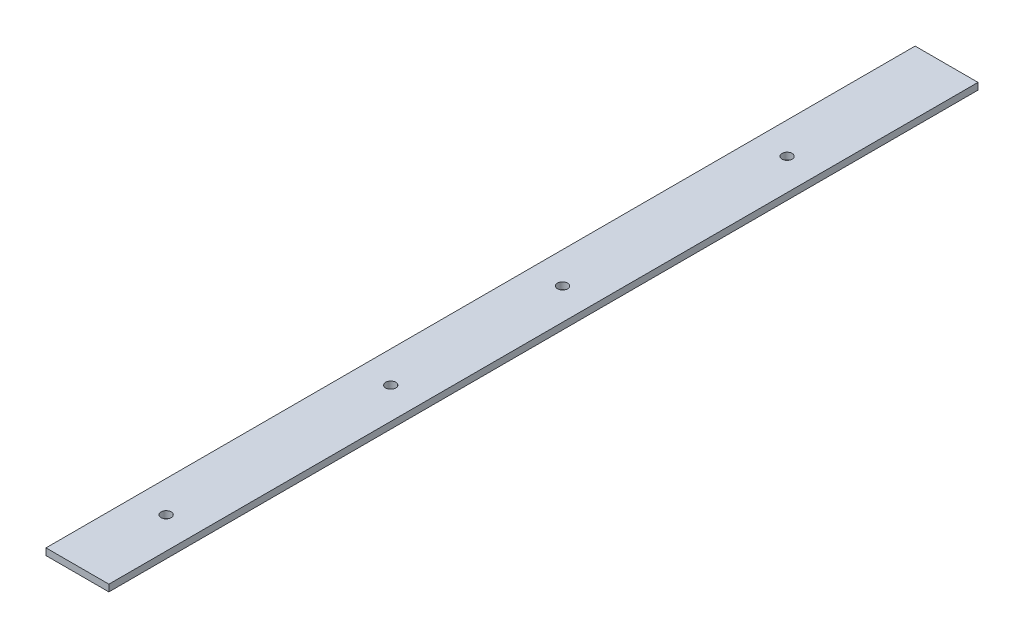
from build123d import *

# Parameters (mm, degrees)
SKETCH1_W            = 28
SKETCH1_H            = 387
BOSS_EXTRUDE1_DEPTH  = 3
M4_CLEARANCE_HOLE1_D = 4.5
LPATTERN2_COUNT      = 2
LPATTERN2_PITCH      = 176.5


with BuildPart() as part:
    # Sketch1 → Boss-Extrude1 (new body)
    with BuildSketch(Plane(origin=(0, 0, 0), x_dir=(1, 0, 0), z_dir=(0, 1, 0))):
        Rectangle(SKETCH1_W, SKETCH1_H)
    extrude(amount=BOSS_EXTRUDE1_DEPTH)

    # M4 Clearance Hole1 (through all)
    with Locations(Plane(origin=(0, 3, 0), x_dir=(1, 0, 0), z_dir=(0, 1, 0))):
        with Locations((0, -154), (0, -54)):
            m4_clearance_hole1 = Hole(M4_CLEARANCE_HOLE1_D / 2)

    # LPattern2: M4 Clearance Hole1 ×2
    with Locations(*[(0, 0, -i * LPATTERN2_PITCH) for i in range(1, LPATTERN2_COUNT)]):
        add(m4_clearance_hole1, mode=Mode.SUBTRACT)


solid = part.part
